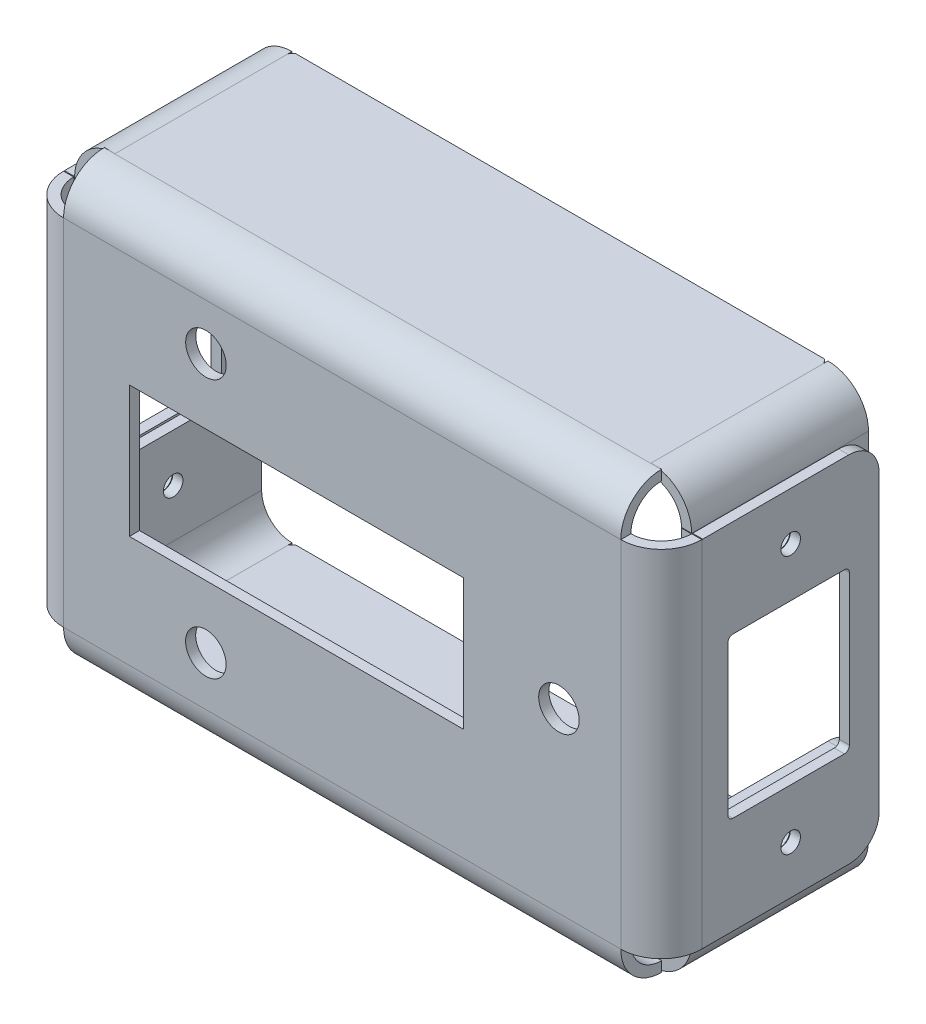
from build123d import *

# Parameters (mm, degrees)
SKETCH1_W                        = 61
SKETCH1_H                        = 41
MAIN_BODY_DEPTH                  = 20.5
CONVERT_SOLID1_START             = -30.5
CONVERT_SOLID1_DEPTH             = 61
CONVERT_SOLID1_2_DEPTH           = 3
CONVERT_SOLID1_START_2           = 27.5
CONVERT_SOLID1_3_DEPTH           = 3
CONVERT_SOLID1_START_3           = -27.5
CONVERT_SOLID1_4_DEPTH           = 55
CONVERT_SOLID1_5_OUTLINE_W       = 1
CONVERT_SOLID1_5_OUTLINE_H       = 17.459701
CONVERT_SOLID1_5_DEPTH           = 61
CONVERT_SOLID1_START_4           = -17.5
CONVERT_SOLID1_6_DEPTH           = 35
CONVERT_SOLID1_7_DEPTH           = 35
CONVERT_SOLID1_8_DEPTH           = 61
SKETCH11_W                       = 0.05
SKETCH11_H                       = 17.459701
TRIM_FOR_TABS_DEPTH              = 58.476081982
CORNER_TAB_STRIP_W               = 10
CORNER_TAB_STRIP_H               = 1
CORNER_TAB_STRIP_CUT_DEPTH       = 17.459701
CORNER_TAB_DEPTH                 = 17.459701
TAB_MIRROR_HORIZ_COPY_1_SKETCH_W = 10
TAB_MIRROR_HORIZ_COPY_1_SKETCH_H = 1
TAB_MIRROR_HORIZ_COPY_1_DEPTH    = 17.459701
TAB_MIRROR_HORIZ_COPY_2_DEPTH    = 17.459701
SKETCH16_R                       = 0.9652
SCREW_HOLES_DEPTH                = 69.113159521
RJ45_HOLES_DEPTH                 = 70.953556021
RJ45_HOLES_DEPTH_BACK            = 70.953556021
SKETCH17_W                       = 12
SKETCH17_H                       = 15.74
FILLET1_R                        = 0.5
SKETCH18_R                       = 2
SKETCH18_W                       = 33
SKETCH18_H                       = 12.95
CUT_EXTRUDE4_DEPTH               = 10
BREAK_CORNER1_START              = -30.5
BREAK_CORNER1_DEPTH              = 61
BREAK_CORNER1_START_2            = -32
BREAK_CORNER1_2_DEPTH            = 1.55
BREAK_CORNER1_START_3            = 30.45
BREAK_CORNER1_3_DEPTH            = 1.55
FOLD_MARKING_NOTCHES_DEPTH       = 58.476081982
FOLD_MARKING_NOTCHES_2_DEPTH     = 70.953556021


with BuildPart() as part:
    # Sketch1 → main body (new body)
    with BuildSketch(Plane.XY):
        Rectangle(SKETCH1_W, SKETCH1_H)
    extrude(amount=MAIN_BODY_DEPTH)

    # Convert-Solid1: read off the stored shape, not the designer's step
    # Convert-Solid1 outline → Convert-Solid1 (cut)
    with BuildSketch(Plane.YZ.offset(CONVERT_SOLID1_START)):
        with BuildLine():
            Line((17.5, 20.5), (17.5, 0))
            Line((17.5, 0), (20.5, 0))
            Line((20.5, 0), (20.5, 17.5))
            ThreePointArc((20.5, 17.5), (19.621320344, 19.621320344), (17.5, 20.5))
        make_face()
        with BuildLine():
            Line((-20.5, 0), (-17.5, 0))
            Line((-17.5, 0), (-17.5, 20.5))
            ThreePointArc((-17.5, 20.5), (-19.621320344, 19.621320344), (-20.5, 17.5))
            Line((-20.5, 17.5), (-20.5, 0))
        make_face()
    extrude(amount=CONVERT_SOLID1_DEPTH, mode=Mode.SUBTRACT)

    # Convert-Solid1 2 outline → Convert-Solid1 2 (cut)
    with BuildSketch(Plane.YZ.offset(CONVERT_SOLID1_START)):
        with BuildLine():
            Line((17.5, 21.5), (17.5, 20.5))
            ThreePointArc((17.5, 20.5), (19.621320344, 19.621320344), (20.5, 17.5))
            Line((20.5, 17.5), (20.5, 20.145751312))
            ThreePointArc((20.5, 20.145751312), (19.145751311, 21.145751311), (17.5, 21.5))
        make_face()
        with BuildLine():
            ThreePointArc((-20.5, 17.5), (-19.621320344, 19.621320344), (-17.5, 20.5))
            Line((-17.5, 20.5), (-17.5, 21.5))
            ThreePointArc((-17.5, 21.5), (-19.145751311, 21.145751311), (-20.5, 20.145751312))
            Line((-20.5, 20.145751312), (-20.5, 17.5))
        make_face()
    extrude(amount=CONVERT_SOLID1_2_DEPTH, mode=Mode.SUBTRACT)

    # Convert-Solid1 3 outline → Convert-Solid1 3 (cut)
    with BuildSketch(Plane.YZ.offset(CONVERT_SOLID1_START_2)):
        with BuildLine():
            Line((17.5, 21.5), (17.5, 20.5))
            ThreePointArc((17.5, 20.5), (19.621320344, 19.621320344), (20.5, 17.5))
            Line((20.5, 17.5), (20.5, 20.145751312))
            ThreePointArc((20.5, 20.145751312), (19.145751311, 21.145751311), (17.5, 21.5))
        make_face()
        with BuildLine():
            ThreePointArc((-20.5, 17.5), (-19.621320344, 19.621320344), (-17.5, 20.5))
            Line((-17.5, 20.5), (-17.5, 21.5))
            ThreePointArc((-17.5, 21.5), (-19.145751311, 21.145751311), (-20.5, 20.145751312))
            Line((-20.5, 20.145751312), (-20.5, 17.5))
        make_face()
    extrude(amount=CONVERT_SOLID1_3_DEPTH, mode=Mode.SUBTRACT)

    # Convert-Solid1 4 outline → Convert-Solid1 4 (add)
    with BuildSketch(Plane.YZ.offset(CONVERT_SOLID1_START_3)):
        with BuildLine():
            Line((20.5, 0), (21.5, 0))
            Line((21.5, 0), (21.5, 17.5))
            ThreePointArc((21.5, 17.5), (20.328427125, 20.328427125), (17.5, 21.5))
            Line((17.5, 21.5), (17.5, 20.5))
            ThreePointArc((17.5, 20.5), (19.621320344, 19.621320344), (20.5, 17.5))
            Line((20.5, 17.5), (20.5, 0))
        make_face()
        with BuildLine():
            Line((-21.5, 0), (-20.5, 0))
            Line((-20.5, 0), (-20.5, 17.5))
            ThreePointArc((-20.5, 17.5), (-19.621320344, 19.621320344), (-17.5, 20.5))
            Line((-17.5, 20.5), (-17.5, 21.5))
            ThreePointArc((-17.5, 21.5), (-20.328427125, 20.328427125), (-21.5, 17.5))
            Line((-21.5, 17.5), (-21.5, 0))
        make_face()
    extrude(amount=CONVERT_SOLID1_4_DEPTH)

    # Convert-Solid1 5 outline → Convert-Solid1 5 (add)
    with BuildSketch(Plane.YZ.offset(CONVERT_SOLID1_START)):
        with Locations((21, 8.7298505)):
            Rectangle(CONVERT_SOLID1_5_OUTLINE_W, CONVERT_SOLID1_5_OUTLINE_H)
        with Locations((-21, 8.7298505)):
            Rectangle(CONVERT_SOLID1_5_OUTLINE_W, CONVERT_SOLID1_5_OUTLINE_H)
    extrude(amount=CONVERT_SOLID1_5_DEPTH)

    # Convert-Solid1 6 outline → Convert-Solid1 6 (add)
    with BuildSketch(Plane(origin=(0, 0, 0), x_dir=(1, 0, 0), z_dir=(0, 1, 0)).offset(CONVERT_SOLID1_START_4)):
        with BuildLine():
            Line((31.5, 0), (30.5, 0))
            Line((30.5, 0), (30.5, -20.145751312))
            ThreePointArc((30.5, -20.145751312), (31.241657387, -18.914213563), (31.5, -17.5))
            Line((31.5, -17.5), (31.5, 0))
        make_face()
        with BuildLine():
            Line((-30.5, -20.145751312), (-30.5, 0))
            Line((-30.5, 0), (-31.5, 0))
            Line((-31.5, 0), (-31.5, -17.5))
            ThreePointArc((-31.5, -17.5), (-31.241657387, -18.914213563), (-30.5, -20.145751312))
        make_face()
        with BuildLine():
            Line((30.145751312, -20.5), (-30.145751312, -20.5))
            ThreePointArc((-30.145751312, -20.5), (-28.914213563, -21.241657387), (-27.5, -21.5))
            Line((-27.5, -21.5), (27.5, -21.5))
            ThreePointArc((27.5, -21.5), (28.914213563, -21.241657387), (30.145751312, -20.5))
        make_face()
    extrude(amount=CONVERT_SOLID1_6_DEPTH)

    # Convert-Solid1 7 outline → Convert-Solid1 7 (cut)
    with BuildSketch(Plane(origin=(0, 0, 0), x_dir=(1, 0, 0), z_dir=(0, 1, 0)).offset(CONVERT_SOLID1_START_4)):
        with BuildLine():
            Line((30.5, -17.5), (30.5, 0))
            Line((30.5, 0), (-30.5, 0))
            Line((-30.5, 0), (-30.5, -17.5))
            ThreePointArc((-30.5, -17.5), (-29.621320344, -19.621320344), (-27.5, -20.5))
            Line((-27.5, -20.5), (27.5, -20.5))
            ThreePointArc((27.5, -20.5), (29.621320344, -19.621320344), (30.5, -17.5))
        make_face()
        with BuildLine():
            Line((30.5, -20.5), (30.5, -20.145751312))
            ThreePointArc((30.5, -20.145751312), (30.328427125, -20.328427125), (30.145751312, -20.5))
            Line((30.145751312, -20.5), (30.5, -20.5))
        make_face()
        with BuildLine():
            ThreePointArc((-30.145751312, -20.5), (-30.328427125, -20.328427125), (-30.5, -20.145751312))
            Line((-30.5, -20.145751312), (-30.5, -20.5))
            Line((-30.5, -20.5), (-30.145751312, -20.5))
        make_face()
    extrude(amount=CONVERT_SOLID1_7_DEPTH, mode=Mode.SUBTRACT)

    # Convert-Solid1 8 outline → Convert-Solid1 8 (cut)
    with BuildSketch(Plane.YZ.offset(CONVERT_SOLID1_START)):
        with BuildLine():
            ThreePointArc((20.145751312, 20.5), (20.328427125, 20.328427125), (20.5, 20.145751312))
            Line((20.5, 20.145751312), (20.5, 20.5))
            Line((20.5, 20.5), (20.145751312, 20.5))
        make_face()
        with BuildLine():
            ThreePointArc((-20.5, 20.145751312), (-20.328427125, 20.328427125), (-20.145751312, 20.5))
            Line((-20.145751312, 20.5), (-20.5, 20.5))
            Line((-20.5, 20.5), (-20.5, 20.145751312))
        make_face()
    extrude(amount=CONVERT_SOLID1_8_DEPTH, mode=Mode.SUBTRACT)

    # Sketch11 → trim for tabs (cut, through all)
    with BuildSketch(Plane.XZ.offset(21.5)):
        with Locations((-30.475, 8.7298505)):
            Rectangle(SKETCH11_W, SKETCH11_H)
    trim_for_tabs = extrude(amount=-TRIM_FOR_TABS_DEPTH, mode=Mode.SUBTRACT)

    # mirror trim: trim for tabs across plane
    add(trim_for_tabs.mirror(Plane(origin=(0, 0, 0), x_dir=(0, 0, 1), z_dir=(1, 0, 0))), mode=Mode.SUBTRACT)

    # corner tab: sheet metal written as solids
    # corner tab strip (on a plane across the edge) → corner tab strip cut (cut)
    with BuildSketch(Plane(origin=(30.45, -20.5, 17.459701), x_dir=(-1, 0, 0), z_dir=(0, 0, -1))):
        with Locations((-1, -0.5)):
            Rectangle(CORNER_TAB_STRIP_W, CORNER_TAB_STRIP_H)
    corner_tab_strip_cut = extrude(amount=CORNER_TAB_STRIP_CUT_DEPTH, mode=Mode.SUBTRACT)

    # corner tab section (on a plane across the edge) → corner tab (add)
    with BuildSketch(Plane(origin=(30.45, -20.5, 17.459701), x_dir=(-1, 0, 0), z_dir=(0, 0, -1))):
        with BuildLine():
            Line((0, 3), (0, 12.5))
            Line((0, 12.5), (1, 12.5))
            Line((1, 12.5), (1, 3))
            ThreePointArc((1, 3), (1.878679656, 0.878679656), (4, 0))
            Line((4, 0), (4, -1))
            ThreePointArc((4, -1), (1.171572875, 0.171572875), (0, 3))
        make_face()
    corner_tab = extrude(amount=CORNER_TAB_DEPTH)

    # tab mirror vert: corner tab strip cut, corner tab across plane
    add(corner_tab_strip_cut.mirror(Plane.ZX), mode=Mode.SUBTRACT)
    add(corner_tab.mirror(Plane.ZX))

    # tab mirror horiz: corner tab strip cut, corner tab across plane
    add(corner_tab_strip_cut.mirror(Plane(origin=(0, 0, 0), x_dir=(0, 0, 1), z_dir=(1, 0, 0))), mode=Mode.SUBTRACT)
    add(corner_tab.mirror(Plane(origin=(0, 0, 0), x_dir=(0, 0, 1), z_dir=(1, 0, 0))))

    # tab mirror horiz copy 1 sketch → tab mirror horiz copy 1 (cut)
    with BuildSketch(Plane(origin=(-30.45, 20.5, 17.459701), x_dir=(1, 0, 0), z_dir=(0, 0, -1))):
        with Locations((-1, -0.5)):
            Rectangle(TAB_MIRROR_HORIZ_COPY_1_SKETCH_W, TAB_MIRROR_HORIZ_COPY_1_SKETCH_H)
    extrude(amount=TAB_MIRROR_HORIZ_COPY_1_DEPTH, mode=Mode.SUBTRACT)

    # tab mirror horiz copy 2 sketch → tab mirror horiz copy 2 (add)
    with BuildSketch(Plane(origin=(-30.45, 20.5, 17.459701), x_dir=(1, 0, 0), z_dir=(0, 0, -1))):
        with BuildLine():
            Line((0, 3), (0, 12.5))
            Line((0, 12.5), (1, 12.5))
            Line((1, 12.5), (1, 3))
            ThreePointArc((1, 3), (1.878679656, 0.878679656), (4, 0))
            Line((4, 0), (4, -1))
            ThreePointArc((4, -1), (1.171572875, 0.171572875), (0, 3))
        make_face()
    extrude(amount=TAB_MIRROR_HORIZ_COPY_2_DEPTH)

    # Sketch16 → screw holes (cut, symmetric)
    with BuildSketch(Plane.ZY.offset(-29.45)):
        with Locations(Location((8.7298505, -12.75, 0), (0, 0, 90))):
            Circle(SKETCH16_R)
    screw_holes = extrude(amount=SCREW_HOLES_DEPTH, both=True, mode=Mode.SUBTRACT)

    # mirror screw holes vert: screw holes across plane
    add(screw_holes.mirror(Plane.ZX), mode=Mode.SUBTRACT)

    # Sketch17 → rj45 holes (cut, two sides: drawn at the far end of the back side and taken through both)
    with BuildSketch(Plane(origin=(31.5, 0, 0), x_dir=(0, 0, -1), z_dir=(1, 0, 0)).offset(-RJ45_HOLES_DEPTH_BACK)):
        with Locations((-8.932892141, 0.022328393)):
            Rectangle(SKETCH17_W, SKETCH17_H)
    extrude(amount=RJ45_HOLES_DEPTH + RJ45_HOLES_DEPTH_BACK, mode=Mode.SUBTRACT)

    # Fillet1
    fillet1_edges = [part.edges().sort_by_distance(p)[0] for p in [
        (31, 7.892328393, 2.932892141),
        (31, -7.847671607, 2.932892141),
        (31, -7.847671607, 14.932892141),
        (31, 7.892328393, 14.932892141),
    ]]
    fillet(fillet1_edges, radius=FILLET1_R)

    # Sketch18 → Cut-Extrude4 (cut)
    with BuildSketch(Plane.XY.offset(21.5)):
        with Locations((21.396805659, 0)):
            Circle(SKETCH18_R)
        with Locations((-13.446557004, 12.9149731)):
            Circle(SKETCH18_R)
        with Locations((-13.455800947, -12.656174973)):
            Circle(SKETCH18_R)
        with Locations((-4.499790271, 0.001448065)):
            Rectangle(SKETCH18_W, SKETCH18_H)
    extrude(amount=-CUT_EXTRUDE4_DEPTH, mode=Mode.SUBTRACT)

    # Break-Corner1: read off the stored shape, not the designer's step
    # Break-Corner1 outline → Break-Corner1 (cut)
    with BuildSketch(Plane.YZ.offset(BREAK_CORNER1_START)):
        with BuildLine():
            ThreePointArc((-11, 17.459701), (-8.878679656, 16.581021344), (-8, 14.459701))
            Line((-8, 14.459701), (-8, 17.459701))
            Line((-8, 17.459701), (-11, 17.459701))
        make_face()
        with BuildLine():
            Line((-8, 0), (-8, 3))
            ThreePointArc((-8, 3), (-8.878679656, 0.878679656), (-11, 0))
            Line((-11, 0), (-8, 0))
        make_face()
        with BuildLine():
            ThreePointArc((8, 14.459701), (8.878679656, 16.581021344), (11, 17.459701))
            Line((11, 17.459701), (8, 17.459701))
            Line((8, 17.459701), (8, 14.459701))
        make_face()
        with BuildLine():
            ThreePointArc((11, 0), (8.878679656, 0.878679656), (8, 3))
            Line((8, 3), (8, 0))
            Line((8, 0), (11, 0))
        make_face()
    extrude(amount=BREAK_CORNER1_DEPTH, mode=Mode.SUBTRACT)

    # Break-Corner1 2 outline → Break-Corner1 2 (cut)
    with BuildSketch(Plane.YZ.offset(BREAK_CORNER1_START_2)):
        with BuildLine():
            ThreePointArc((-14.5, 0), (-16.621320344, 0.878679656), (-17.5, 3))
            Line((-17.5, 3), (-17.5, 0))
            Line((-17.5, 0), (-14.5, 0))
        make_face()
        with BuildLine():
            Line((17.5, 0), (17.5, 3))
            ThreePointArc((17.5, 3), (16.621320344, 0.878679656), (14.5, 0))
            Line((14.5, 0), (17.5, 0))
        make_face()
    extrude(amount=BREAK_CORNER1_2_DEPTH, mode=Mode.SUBTRACT)

    # Break-Corner1 3 outline → Break-Corner1 3 (cut)
    with BuildSketch(Plane.YZ.offset(BREAK_CORNER1_START_3)):
        with BuildLine():
            ThreePointArc((-14.5, 0), (-16.621320344, 0.878679656), (-17.5, 3))
            Line((-17.5, 3), (-17.5, 0))
            Line((-17.5, 0), (-14.5, 0))
        make_face()
        with BuildLine():
            Line((17.5, 0), (17.5, 3))
            ThreePointArc((17.5, 3), (16.621320344, 0.878679656), (14.5, 0))
            Line((14.5, 0), (17.5, 0))
        make_face()
    extrude(amount=BREAK_CORNER1_3_DEPTH, mode=Mode.SUBTRACT)

    # Sketch19 → fold marking notches (cut, through all)
    with BuildSketch(Plane(origin=(0, 21.5, 0), x_dir=(1, 0, 0), z_dir=(0, 1, 0))):
        Polygon((26.116297313, 0), (26.45, -0.385195079), (26.45, 0), align=None)
    fold_marking_notches = extrude(amount=-FOLD_MARKING_NOTCHES_DEPTH, mode=Mode.SUBTRACT)

    # mirror fold marking notches: fold marking notches across plane
    add(fold_marking_notches.mirror(Plane(origin=(0, 0, 0), x_dir=(0, 0, 1), z_dir=(1, 0, 0))), mode=Mode.SUBTRACT)

    # Sketch20 → fold marking notches 2 (cut, through all)
    with BuildSketch(Plane.ZY.offset(31.5)):
        Polygon((17.5, -17.5), (17.5, -17.394004016), (17.41254312, -17.5), align=None)
    fold_marking_notches_2 = extrude(amount=-FOLD_MARKING_NOTCHES_2_DEPTH, mode=Mode.SUBTRACT)

    # mirror fold marking notches vert: fold marking notches 2 across plane
    add(fold_marking_notches_2.mirror(Plane.ZX), mode=Mode.SUBTRACT)


solid = part.part
